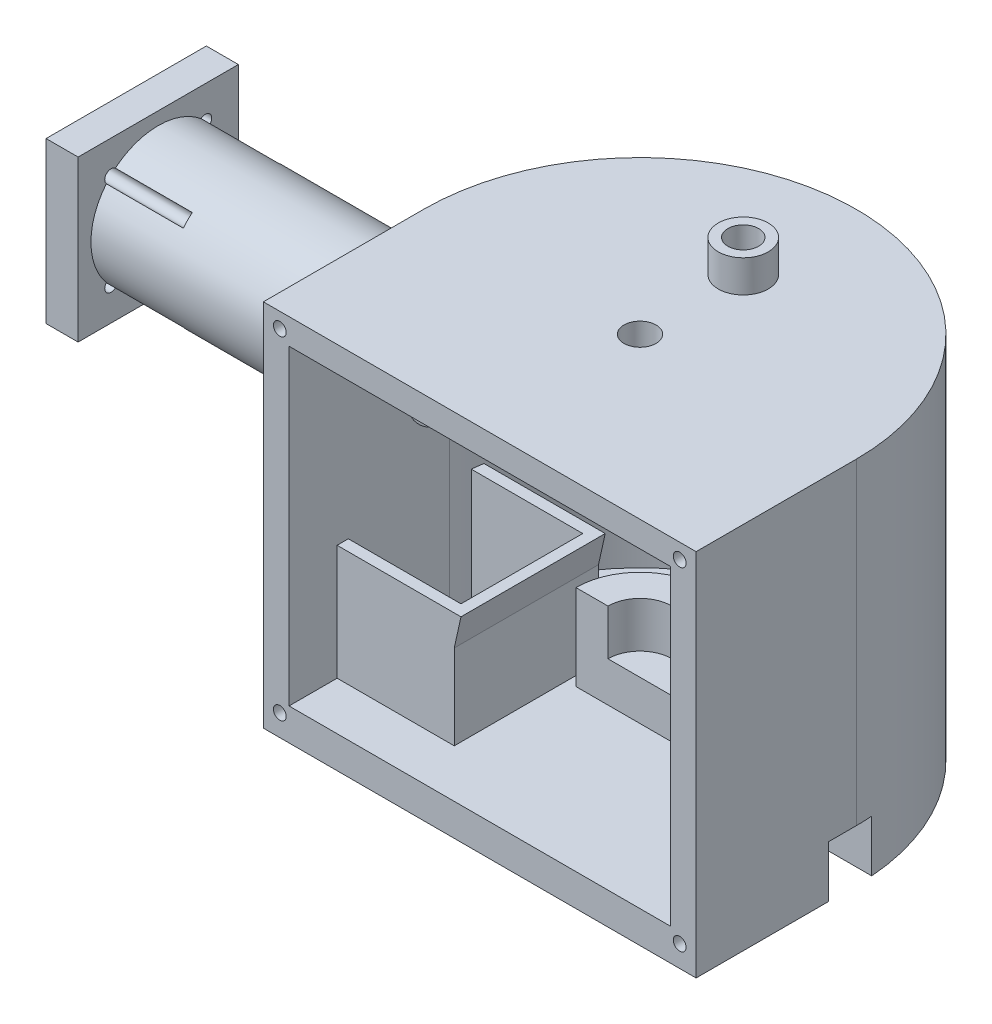
from build123d import *
from build123d.topology import SkipClean

# Parameters (mm, degrees)
BOSS_EXTRUDE3_DEPTH                   = 50
BOSS_EXTRUDE1_DEPTH                   = 6.25
BOSS_EXTRUDE2_START                   = -6.25
BOSS_EXTRUDE2_DEPTH                   = 2.5
REVOLVE2_ANGLE                        = 180.0000000000004
REVOLVE4_ANGLE                        = 180.0000000000004
REVOLVE7_ANGLE                        = 180.0000000000004
SKETCH5_W                             = 50
SKETCH5_H                             = 50
SKETCH5_R                             = 20.999999999999982
BOSS_EXTRUDE4_DEPTH                   = 10
SKETCH6_R                             = 2
CAMERA_HEAT_SET_INSERT_CUT_DEPTH      = 34
SERVO_START                           = 67.5
SKETCH9_W                             = 13.671614749408555
SKETCH9_H                             = 17.27317049769859
SERVO_WIRE_CUT_DEPTH                  = 17.128199468
REVOLVE9_OUTLINE_W                    = 2.999999999999999
REVOLVE9_OUTLINE_H                    = 10.048090032999966
BOSS_EXTRUDE5_DEPTH                   = 35.00000000000001
BOSS_EXTRUDE5_DEPTH_BACK              = 10
SKETCH11_W                            = 3.4999999999999964
SKETCH11_H                            = 26.44043515878529
BOSS_EXTRUDE6_START                   = 31.5
SKETCH11_3_W                          = 33.047923561932336
SKETCH11_3_H                          = 26.44043515878529
BOSS_EXTRUDE6_DEPTH                   = 3.5
BOSS_EXTRUDE7_START                   = -10
SKETCH11_5_W                          = 33.047923561932336
SKETCH11_5_H                          = 26.44043515878529
BOSS_EXTRUDE7_DEPTH                   = 3.5
SKETCH12_R                            = 2.000000000000003
HEAT_SET_INSERT_CUT_DEPTH             = 17
HEAT_SET_INSERT_CUT_DIRECTION_2_REACH = 205.302
SKETCH14_R                            = 2.0000000000000036
SKETCH14_R_2                          = 1.9999999999999967
SKETCH14_R_3                          = 1.9999999999999962
SKETCH14_R_4                          = 2.0000000000000027
PANEL_HEAT_SET_INSERT_CUT_DEPTH       = 10


# Read off the part's stored shape, not the designer's step: Cut-Revolve3, Revolve9
with BuildPart() as part:
    # Sketch4 → Boss-Extrude3 (new body)
    with BuildSketch(Plane.XY):
        Polygon((5.000000000000001, 87.19879482084548), (59.5, 87.19879482084548), (59.499999999999986, 8.999999999999998), (59.50000000000001, -20.000000000000004), (67.5, -20.000000000000018), (67.49999999999999, 95.19879482084548), (5, 95.19879482084548), (-3.2678e-13, 95.19879482084548), (9.8e-16, 87.19879482084548), align=None)
        Polygon((59.50000000000001, -10), (50.37180053185802, -10.000000000000007), (26.371800531858028, -10.000000000000007), (-3.55e-15, -10.000000000000005), (0, -20), (17.24360106371605, -20.000000000000004), (59.50000000000001, -20.000000000000004), align=None)
    boss_extrude3 = extrude(amount=BOSS_EXTRUDE3_DEPTH)

    # Mirror1: Boss-Extrude3 across plane
    add(boss_extrude3.mirror(Plane(origin=(-6.94e-15, 0, 50), x_dir=(0, 0, 1), z_dir=(1, 3.5e-16, 0))))

    # Sketch1<5> → Boss-Extrude1 (add, symmetric)
    with BuildSketch(Plane.XY):
        Polygon((17.24360106371605, -20.000000000000004), (59.50000000000001, -20.000000000000004), (59.49999999999998, 8.999999999999996), (50.37180053185802, 8.999999999999998), (50.37180053185802, -10.000000000000007), (26.371800531858028, -10.000000000000005), (26.371800531858028, 8.999999999999998), (17.24360106371607, 8.999999999999998), align=None)
    extrude(amount=BOSS_EXTRUDE1_DEPTH, both=True)

    # Sketch1<6> → Boss-Extrude2 (add)
    with BuildSketch(Plane.XY.offset(BOSS_EXTRUDE2_START)):
        Polygon((19.999999999999993, -20.000000000000004), (59.50000000000001, -20.000000000000004), (59.49999999999998, 8.999999999999996), (19.999999999999993, 8.999999999999998), align=None)
    extrude(amount=-BOSS_EXTRUDE2_DEPTH)

    # Sketch1 → Revolve2 (revolve)
    with BuildSketch(Plane.XY):
        Polygon((5.000000000000001, 87.19879482084548), (59.5, 87.19879482084548), (59.499999999999986, 8.999999999999998), (59.50000000000001, -20.000000000000004), (67.5, -20.000000000000018), (67.49999999999999, 95.19879482084548), (5, 95.19879482084548), align=None)
        Polygon((-1e-17, -10.000000000000005), (0, -20), (17.24360106371605, -20.000000000000004), (17.243601063716056, -10.000000000000016), align=None)
        Polygon((19.999999999999996, -10.000000000000007), (19.999999999999996, -20.000000000000004), (59.50000000000001, -20.000000000000004), (59.5, -10.000000000000002), (50.37180053185802, -10.000000000000007), (26.371800531858028, -10.000000000000007), align=None)
        Polygon((17.243601063716056, -10.000000000000009), (17.24360106371605, -20), (19.999999999999993, -20.000000000000004), (19.999999999999996, -10.000000000000007), align=None)
    revolve(axis=Axis((3.43025e-12, -1000, 0), (-3.43e-15, 1, 0)), revolution_arc=REVOLVE2_ANGLE)

    # Sketch1<11> → Cut-Revolve2 (revolve, cut)
    with SkipClean():  # the faces are left unmerged after this step: merging them gives an invalid solid
        with BuildSketch(Plane.XY):
            Polygon((-3.2678e-13, 95.19879482084548), (9.8e-16, 87.19879482084548), (5.000000000000001, 87.19879482084548), (5, 95.19879482084548), align=None)
        revolve(axis=Axis((3.43025e-12, -1000, 0), (-3.43e-15, 1, 0)), mode=Mode.SUBTRACT)

    # Sketch1<10> → Revolve4 (revolve)
    with SkipClean():  # the faces are left unmerged after this step: merging them gives an invalid solid
        with BuildSketch(Plane.XY):
            Polygon((-1e-17, 2.4999999999999987), (-1e-17, -10.000000000000005), (17.243601063716056, -10.000000000000007), (17.24360106371607, 8.999999999999998), (19.999999999999996, 8.999999999999998), (19.999999999999996, 16.750000000000004), (9.999999999999998, 16.75), (10, 2.5), align=None)
            Polygon((17.24360106371607, 8.999999999999998), (17.243601063716056, -10.000000000000009), (19.999999999999996, -10.000000000000007), (19.999999999999996, 8.999999999999998), align=None)
        revolve(axis=Axis((3.43025e-12, -1000, 0), (-3.43e-15, 1, 0)), revolution_arc=REVOLVE4_ANGLE)

    # Sketch3 → Cut-Revolve1 (revolve, cut)
    with SkipClean():  # the faces are left unmerged after this step: merging them gives an invalid solid
        with BuildSketch(Plane.XY, mode=Mode.PRIVATE) as cut_revolve1_sk:
            Polygon((-49.874960717844324, 68.91457792872573), (-59.5000000000006, 68.91457792872573), (-66.84693861983249, 68.91457792872572), (-83.96943457097422, 68.91457792872572), (-83.9694345709742, 55.414577928725734), (-74.36832294933103, 55.414577928725734), (-58.243601063716426, 55.414577928725734), (-49.874960717844324, 55.414577928725734), align=None)
        revolve(cut_revolve1_sk.sketch.rotate(Axis((-74.36832294933103, 55.414577928725734, 0), (1, 0, 0)), 180), axis=Axis((-74.36832294933103, 55.414577928725734, 0), (1, 0, 0)), mode=Mode.SUBTRACT)

    # Sketch3<6> → Revolve6 (revolve)
    with SkipClean():  # the faces are left unmerged after this step: merging them gives an invalid solid
        with BuildSketch(Plane.XY, mode=Mode.PRIVATE) as revolve6_sk:
            Polygon((-66.84693861983249, 76.41457792872572), (-66.84693861983249, 68.91457792872572), (-141.80365424198564, 68.9145779287257), (-141.80365424198567, 76.41457792872572), align=None)
            Polygon((-59.5000000000006, 73.41457792872572), (-59.5000000000006, 68.91457792872573), (-66.84693861983249, 68.91457792872572), (-66.84693861983249, 76.41457792872572), (-59.5000000000006, 76.41457792872572), align=None)
        revolve(revolve6_sk.sketch.rotate(Axis((-74.36832294933103, 55.414577928725734, 0), (1, 0, 0)), 90), axis=Axis((-74.36832294933103, 55.414577928725734, 0), (1, 0, 0)))

    # Sketch3<7> → Revolve7 (revolve, symmetric)
    with SkipClean():  # the faces are left unmerged after this step: merging them gives an invalid solid
        with BuildSketch(Plane.XY) as revolve7_sk:
            Polygon((-40.33562178635272, 73.41457792872572), (-59.5000000000006, 73.41457792872572), (-59.5000000000006, 68.91457792872573), (-49.874960717844324, 68.91457792872573), (-42.835621786352725, 68.91457792872573), (-42.835621786352725, 64.3620199780883), (-40.33562178635272, 64.36201997808831), align=None)
        revolve(axis=Axis((-74.36832294933103, 55.414577928725734, 0), (1, 0, 0)), revolution_arc=REVOLVE7_ANGLE / 2)
        revolve(revolve7_sk.sketch, axis=Axis((-74.36832294933103, 55.414577928725734, 0), (-1, 0, 0)), revolution_arc=REVOLVE7_ANGLE / 2)

    # Sketch3<8> → Revolve8 (revolve)
    with SkipClean():  # the faces are left unmerged after this step: merging them gives an invalid solid
        with BuildSketch(Plane.XY, mode=Mode.PRIVATE) as revolve8_sk:
            Polygon((-141.80365424198564, 71.10587427750585), (-141.80365424198567, 76.41457792872572), (-160.30724517605262, 76.41457792872572), (-160.30724517605262, 71.10587427750583), align=None)
        revolve(revolve8_sk.sketch.rotate(Axis((-74.36832294933103, 55.414577928725734, 0), (1, 0, 0)), 90), axis=Axis((-74.36832294933103, 55.414577928725734, 0), (1, 0, 0)))

    # Sketch5 → Boss-Extrude4 (add)
    with SkipClean():  # the faces are left unmerged after this step: merging them gives an invalid solid
        with BuildSketch(Plane.ZY.offset(160.30724517605262)):
            with Locations((-7.11e-15, 55.41457792872572)):
                Rectangle(SKETCH5_W, SKETCH5_H)
            with Locations((0, 55.414577928725734)):
                Circle(SKETCH5_R, mode=Mode.SUBTRACT)
        extrude(amount=-BOSS_EXTRUDE4_DEPTH)

    # Sketch6 → Camera Heat Set Insert Cut (cut)
    with SkipClean():  # the faces are left unmerged after this step: merging them gives an invalid solid
        with BuildSketch(Plane.ZY.offset(160.30724517605262)):
            with Locations((14.692307279176049, 70.10688520790178)):
                Circle(SKETCH6_R)
            with Locations((-14.692307279176049, 70.10688520790178)):
                Circle(SKETCH6_R)
            with Locations((-14.692307279176049, 40.722270649549685)):
                Circle(SKETCH6_R)
            with Locations((14.692307279176049, 40.722270649549685)):
                Circle(SKETCH6_R)
        extrude(amount=-CAMERA_HEAT_SET_INSERT_CUT_DEPTH, mode=Mode.SUBTRACT)

    # Sketch9 → Servo Wire Cut (cut)
    with SkipClean():  # the faces are left unmerged after this step: merging them gives an invalid solid
        with BuildSketch(Plane(origin=(0, 0, 0), x_dir=(0, 0, -1), z_dir=(1, 0, 0)).offset(SERVO_START)):
            with Locations((-1.8602698544163516, -12.475825553974834)):
                Rectangle(SKETCH9_W, SKETCH9_H)
        extrude(amount=-SERVO_WIRE_CUT_DEPTH, mode=Mode.SUBTRACT)

    # Cut-Revolve3 outline → Cut-Revolve3 (revolve, cut)
    with SkipClean():  # the faces are left unmerged after this step: merging them gives an invalid solid
        with BuildSketch(Plane.XY.offset(-32.213526423)):
            Polygon((4.8, 95.198794821), (0, 95.198794821), (0, 87.198794821), (2.8, 87.198794821), align=None)
        revolve(axis=Axis((0, 0, -32.213526423), (0, 1, 0)), mode=Mode.SUBTRACT)

    # Revolve9 outline → Revolve9 (revolve)
    with SkipClean():  # the faces are left unmerged after this step: merging them gives an invalid solid
        with BuildSketch(Plane.XY.offset(-32.213526423)):
            with Locations((6.299999999999999, 100.2228398375)):
                Rectangle(REVOLVE9_OUTLINE_W, REVOLVE9_OUTLINE_H)
            Polygon((3.8, 82.301377514), (4.8, 87.198794821), (2.8, 87.198794821), (1.8, 82.301377514), align=None)
        revolve(axis=Axis((0, 0, -32.213526423), (0, 1, 0)))

    # Sketch11 → Boss-Extrude5 (add, two sides: drawn at the far end of the back side and taken through both)
    with SkipClean():  # the faces are left unmerged after this step: merging them gives an invalid solid
        with BuildSketch(Plane.XY.offset(-BOSS_EXTRUDE5_DEPTH_BACK)):
            with Locations((-24.702076438067586, 3.2202175793922336)):
                Rectangle(SKETCH11_W, SKETCH11_H)
            Polygon((-26.452076438067586, 16.44043515878488), (-22.952076438067586, 16.44043515878488), (-20.857370462381017, 25.9166705180169), (-24.357370462381017, 25.9166705180169), align=None)
        extrude(amount=BOSS_EXTRUDE5_DEPTH + BOSS_EXTRUDE5_DEPTH_BACK)

    # Sketch11<3> → Boss-Extrude6 (add)
    with SkipClean():  # the faces are left unmerged after this step: merging them gives an invalid solid
        with BuildSketch(Plane.XY.offset(BOSS_EXTRUDE6_START)):
            with Locations((-42.976038219033754, 3.2202175793922336)):
                Rectangle(SKETCH11_3_W, SKETCH11_3_H)
            Polygon((-59.49999999999992, 16.44043515878488), (-26.452076438067586, 16.44043515878488), (-24.357370462381017, 25.9166705180169), (-59.50000000000006, 25.91667051801689), align=None)
        extrude(amount=BOSS_EXTRUDE6_DEPTH)

    # Sketch11<5> → Boss-Extrude7 (add)
    with SkipClean():  # the faces are left unmerged after this step: merging them gives an invalid solid
        with BuildSketch(Plane.XY.offset(BOSS_EXTRUDE7_START)):
            with Locations((-42.976038219033754, 3.2202175793922336)):
                Rectangle(SKETCH11_5_W, SKETCH11_5_H)
            Polygon((-59.49999999999992, 16.44043515878488), (-26.452076438067586, 16.44043515878488), (-24.357370462381017, 25.9166705180169), (-59.50000000000006, 25.91667051801689), align=None)
        extrude(amount=BOSS_EXTRUDE7_DEPTH)

    # Sketch12 → Heat Set Insert Cut (cut)
    with SkipClean():  # the faces are left unmerged after this step: merging them gives an invalid solid
        with BuildSketch(Plane.XY):
            with Locations((54.93590026592901, 1.5017022546615009)):
                Circle(SKETCH12_R)
            with Locations(Location((15, 1.5017022546615009, 0), (0, 0, 180))):
                Circle(SKETCH12_R)
        extrude(amount=-HEAT_SET_INSERT_CUT_DEPTH, mode=Mode.SUBTRACT)

    # Heat Set Insert Cut direction 2: up to this face of the body (flat: up to its plane)
    heat_set_insert_cut_direction_2_end = Plane(part.part.faces().sort_by_distance((54.935900266, 2.580379847, 6.25))[0])
    # Sketch12 → Heat Set Insert Cut direction 2 (cut, up to the picked face)
    with BuildSketch(Plane.XY, mode=Mode.PRIVATE) as heat_set_insert_cut_direction_2_sk1:
        with Locations((54.93590026592901, 1.5017022546615009)):
            Circle(SKETCH12_R)
    heat_set_insert_cut_direction_2_tool1 = split(extrude(heat_set_insert_cut_direction_2_sk1.sketch, amount=HEAT_SET_INSERT_CUT_DIRECTION_2_REACH, mode=Mode.PRIVATE), bisect_by=heat_set_insert_cut_direction_2_end, keep=Keep.BOTH, mode=Mode.PRIVATE)
    # Sketch12 → Heat Set Insert Cut direction 2 (cut, up to the picked face)
    with BuildSketch(Plane.XY, mode=Mode.PRIVATE) as heat_set_insert_cut_direction_2_sk2:
        with Locations(Location((15, 1.5017022546615009, 0), (0, 0, 180))):
            Circle(SKETCH12_R)
    heat_set_insert_cut_direction_2_tool2 = split(extrude(heat_set_insert_cut_direction_2_sk2.sketch, amount=HEAT_SET_INSERT_CUT_DIRECTION_2_REACH, mode=Mode.PRIVATE), bisect_by=heat_set_insert_cut_direction_2_end, keep=Keep.BOTH, mode=Mode.PRIVATE)
    add(heat_set_insert_cut_direction_2_tool1.solids().sort_by(Axis((54.9359, 1.501702, 0), (0, 0, 1)))[0], mode=Mode.SUBTRACT)
    add(heat_set_insert_cut_direction_2_tool2.solids().sort_by(Axis((15, 1.501702, 0), (0, 0, 1)))[0], mode=Mode.SUBTRACT)

    # Sketch14 → Panel Heat Set Insert Cut (cut)
    with SkipClean():  # the faces are left unmerged after this step: merging them gives an invalid solid
        with BuildSketch(Plane.XY.offset(50)):
            with Locations((-62.37975423140238, 90.49159388546896)):
                Circle(SKETCH14_R)
            with Locations((62.37975423140232, 90.49159388546896)):
                Circle(SKETCH14_R_2)
            with Locations((62.37975423140232, -13.292799064623564)):
                Circle(SKETCH14_R_3)
            with Locations((-62.37975423140238, -13.292799064623564)):
                Circle(SKETCH14_R_4)
        extrude(amount=-PANEL_HEAT_SET_INSERT_CUT_DEPTH, mode=Mode.SUBTRACT)


solid = part.part
